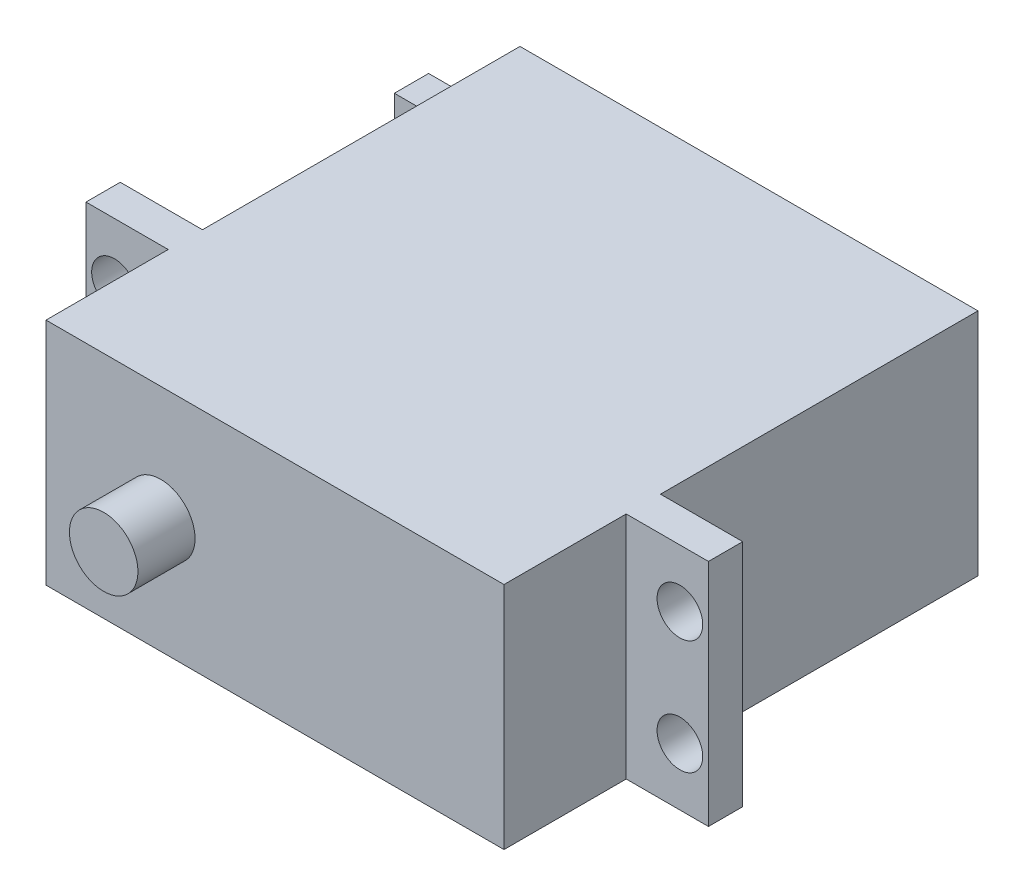
from build123d import *

# Parameters (mm, degrees)
SKETCH1_R           = 3
BOSS_EXTRUDE1_DEPTH = 2.5
SKETCH2_W           = 40.1
SKETCH2_H           = 20.1
BOSS_EXTRUDE2_DEPTH = 41.5
BOSS_EXTRUDE3_START = -27.8
SKETCH3_W           = 7.2
SKETCH3_H           = 20.1
BOSS_EXTRUDE3_DEPTH = 3
SKETCH4_R           = 2
CUT_EXTRUDE1_DEPTH  = 50.368056474
SKETCH5_W           = 3
SKETCH5_H           = 8
BOSS_EXTRUDE4_DEPTH = 8


with BuildPart() as part:
    # Sketch1 → Boss-Extrude1 (new, symmetric)
    with BuildSketch(Plane.XY):
        Circle(SKETCH1_R)
    extrude(amount=BOSS_EXTRUDE1_DEPTH, both=True)

    # Sketch2 → Boss-Extrude2 (add)
    with BuildSketch(Plane(origin=(0, 0, -2.5), x_dir=(-1, 0, 0), z_dir=(0, 0, -1))):
        with Locations((-10, 0)):
            Rectangle(SKETCH2_W, SKETCH2_H)
    extrude(amount=BOSS_EXTRUDE2_DEPTH)

    # Sketch3 → Boss-Extrude3 (add)
    with BuildSketch(Plane(origin=(0, 0, -44), x_dir=(-1, 0, 0), z_dir=(0, 0, -1)).offset(BOSS_EXTRUDE3_START)):
        with Locations((-33.65, 0)):
            Rectangle(SKETCH3_W, SKETCH3_H)
        with Locations((13.65, 0)):
            Rectangle(SKETCH3_W, SKETCH3_H)
    extrude(amount=-BOSS_EXTRUDE3_DEPTH)

    # Sketch4 → Cut-Extrude1 (cut, through all)
    with BuildSketch(Plane.XY.offset(-13.2)):
        with Locations((-14.75, -5)):
            Circle(SKETCH4_R)
        with Locations((-14.75, 5)):
            Circle(SKETCH4_R)
        with Locations((34.75, 5)):
            Circle(SKETCH4_R)
        with Locations((34.75, -5)):
            Circle(SKETCH4_R)
    extrude(amount=-CUT_EXTRUDE1_DEPTH, mode=Mode.SUBTRACT)

    # Sketch5 → Boss-Extrude4 (add)
    with BuildSketch(Plane.ZY.offset(10.05)):
        with Locations((-42.5, 0)):
            Rectangle(SKETCH5_W, SKETCH5_H)
    extrude(amount=BOSS_EXTRUDE4_DEPTH)


solid = part.part
